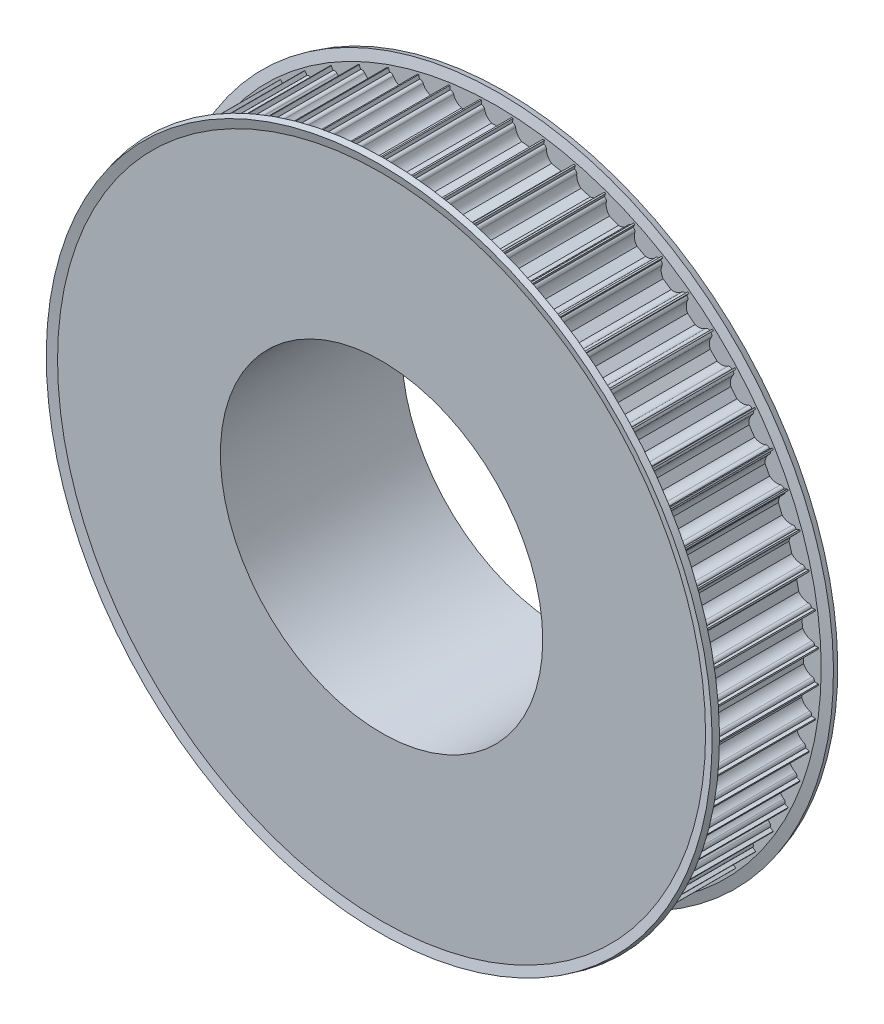
from build123d import *

# Parameters (mm, degrees)
CUT_EXTRUDE1_REACH = 123.758
CIRPATTERN1_COUNT  = 64


with BuildPart() as part:
    # Sketch1 → Revolve1 (revolve)
    with BuildSketch(Plane(origin=(0, 0, 0), x_dir=(0, 0, -1), z_dir=(1, 0, 0))):
        Polygon((0, 40), (45, 40), (45, 55.5), (30, 55.5), (30, 80), (0, 80), align=None)
    revolve(axis=Axis((0, 0, 0), (0, 0, -1)))

    # Sketch2 → Cut-Extrude1 (cut, up to next)
    with BuildSketch(Plane.XY, mode=Mode.PRIVATE) as cut_extrude1_sk1:
        with BuildLine():
            Line((-3.674234614, 79), (-3.75, 79))
            Line((-3.75, 79), (-3.75, 81))
            Line((-3.75, 81), (3.75, 81))
            Line((3.75, 81), (3.75, 79))
            Line((3.75, 79), (3.674234614, 79))
            ThreePointArc((3.674234614, 79), (3.199892965, 78.830947502), (2.939387691, 78.4))
            ThreePointArc((2.939387691, 78.4), (2.331759211, 77.112435701), (1.198957881, 76.25))
            Line((1.198957881, 76.25), (-1.198957881, 76.25))
            ThreePointArc((-1.198957881, 76.25), (-2.331759211, 77.112435701), (-2.939387691, 78.4))
            ThreePointArc((-2.939387691, 78.4), (-3.199892965, 78.830947502), (-3.674234614, 79))
        make_face()
    cut_extrude1_tool1 = extrude(cut_extrude1_sk1.sketch, amount=-CUT_EXTRUDE1_REACH, mode=Mode.PRIVATE) & part.part
    cut_extrude1 = cut_extrude1_tool1.solids().sort_by_distance((0, 78.935169, 0))[0]
    add(cut_extrude1, mode=Mode.SUBTRACT)

    # CirPattern1: Cut-Extrude1 ×64 about axis
    cirpattern1_axis = Axis((0, 0, 0), (0, 0, 1))
    for i in range(1, CIRPATTERN1_COUNT):
        add(cut_extrude1.rotate(cirpattern1_axis, i * 360 / CIRPATTERN1_COUNT), mode=Mode.SUBTRACT)

    # Sketch4 → Revolve2 (revolve)
    with BuildSketch(Plane(origin=(0, 0, 0), x_dir=(0, 0, -1), z_dir=(1, 0, 0))):
        Polygon((30, 55.5), (30, 80.412521254), (30.591966801, 82.621771432), (29.143078062, 83.01), (28.5, 80.61), (28.5, 55.5), align=None)
        Polygon((1.5, 80.61), (1.5, 55.5), (0, 55.5), (0, 80.412521254), (-0.591966801, 82.621771432), (0.856921938, 83.01), align=None)
    revolve(axis=Axis((0, 0, 0), (0, 0, 1)))


solid = part.part
